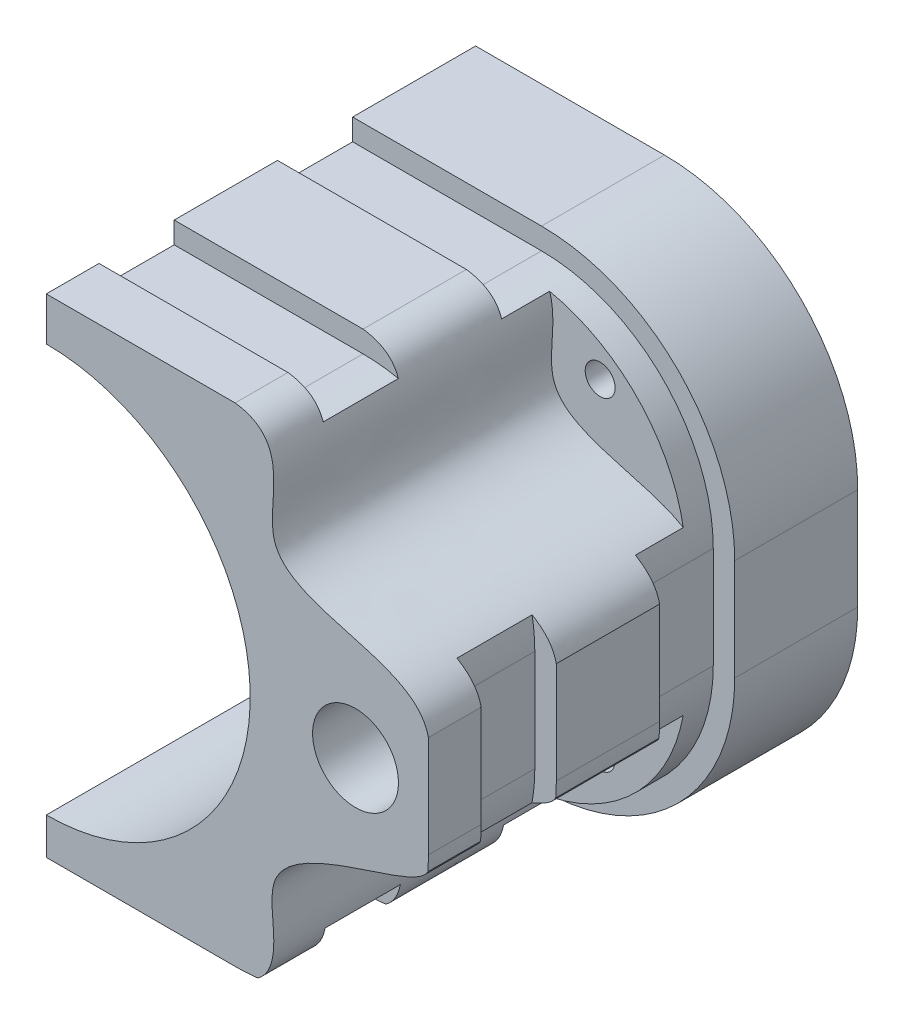
from build123d import *

# Parameters (mm, degrees)
ESBO_O1_R                = 1.393053459
ESBO_O1_R_2              = 4
ESBO_O1_R_3              = 1.370583382
RESSALTO_EXTRUS_O1_DEPTH = 40
CORTE_EXTRUS_O1_START    = -26
ESBO_O5_R                = 1.370583382
CORTE_EXTRUS_O1_DEPTH    = 26
ESBO_O8_W                = 7
ESBO_O8_H                = 2


with BuildPart() as part:
    # Esboço1 → Ressalto-extrusão1 (new body)
    with BuildSketch(Plane.XY):
        with BuildLine():
            Line((-90, -22.423877672), (-90, -19))
            ThreePointArc((-90, -19), (-71, 0), (-90, 19))
            Line((-90, 19), (-90, 23.042521341))
            Line((-90, 23.042521341), (-72.401791427, 23.042521341))
            ThreePointArc((-72.401791427, 23.042521341), (-59.673869366, 17.770443402), (-54.401791427, 5.042521341))
            Line((-54.401791427, 5.042521341), (-54.401791427, -4.423877672))
            ThreePointArc((-54.401791427, -4.423877672), (-59.673869366, -17.151799733), (-72.401791427, -22.423877672))
            Line((-72.401791427, -22.423877672), (-90, -22.423877672))
        make_face()
        with Locations((-64.399704634, 15.948259466)):
            Circle(ESBO_O1_R, mode=Mode.SUBTRACT)
        with Locations((-61.189365531, 0)):
            Circle(ESBO_O1_R_2, mode=Mode.SUBTRACT)
        with Locations((-64.399704634, -14.228928105)):
            Circle(ESBO_O1_R_3, mode=Mode.SUBTRACT)
    extrude(amount=RESSALTO_EXTRUS_O1_DEPTH)

    # Esboço5 → Corte-extrusão1 (cut)
    # profile 1 of 2: a face of its own
    with BuildSketch(Plane.XY.offset(40).offset(CORTE_EXTRUS_O1_START)):
        with BuildLine():
            add(Edge.make_bspline(
                [(-54.401791427, 5.042521341), (-55.530001159, 10.383788665), (-70.453859237, 8.636772089), (-68.317241022, 19.151967947), (-69.419494496, 22.655429754), (-72.401791427, 23.042521341)],
                knots=[0, 0, 0, 0, 0.59841234, 0.778329044, 1, 1, 1, 1], degree=3))
            ThreePointArc((-54.401791427, 5.042521341), (-59.673869366, 17.770443402), (-72.401791427, 23.042521341))
        make_face()
    # profile 2 of 2: a face of its own
    with BuildSketch(Plane.XY.offset(40).offset(CORTE_EXTRUS_O1_START)):
        with BuildLine():
            add(Edge.make_bspline(
                [(-54.455116699, -5.808387052), (-55.021642733, -6.906023952), (-60.824639792, -8.65742119), (-69.99744996, -12.030398314), (-68.624992944, -17.552582132), (-68.947451642, -20.712215011), (-69.65151808, -21.847158712), (-70.29295532, -22.299917789)],
                knots=[0.054307943, 0.054307943, 0.054307943, 0.054307943, 0.303140082, 0.59841234, 0.778329044, 0.849345989, 0.932732603, 0.932732603, 0.932732603, 0.932732603], degree=3))
            ThreePointArc((-70.29295532, -22.299917789), (-59.419167454, -16.891895749), (-54.455116699, -5.808387052))
        make_face()
        with Locations((-64.399704634, -14.228928105)):
            Circle(ESBO_O5_R, mode=Mode.SUBTRACT)
    extrude(amount=CORTE_EXTRUS_O1_DEPTH, mode=Mode.SUBTRACT)

    # Varredura de corte1: sweep along a path in Esboço7
    with BuildLine(Plane.XY.offset(40)) as varredura_de_corte1_path:
        Line((-90, 23.042521341), (-72.401791427, 23.042521341))
        ThreePointArc((-72.401791427, 23.042521341), (-59.673869366, 17.770443402), (-54.401791427, 5.042521341))
        Line((-54.401791427, 5.042521341), (-54.401791427, -4.423877672))
        ThreePointArc((-54.401791427, -4.423877672), (-54.415127686, -5.116645636), (-54.455116699, -5.808387052))
        ThreePointArc((-54.455116699, -5.808387052), (-59.419167454, -16.891895749), (-70.29295532, -22.299917789))
        ThreePointArc((-70.29295532, -22.299917789), (-71.345553317, -22.392860978), (-72.401791427, -22.423877672))
        Line((-72.401791427, -22.423877672), (-90, -22.423877672))
    # Esboço8 → Varredura de corte1 (sweep, cut)
    with BuildSketch(Plane.ZY.offset(90)):
        with Locations((31.583750193, 22.042521341)):
            Rectangle(ESBO_O8_W, ESBO_O8_H)
        with Locations((14.959531016, 22.042521341)):
            Rectangle(ESBO_O8_W, ESBO_O8_H)
    sweep(path=varredura_de_corte1_path.line, mode=Mode.SUBTRACT)


solid = part.part
